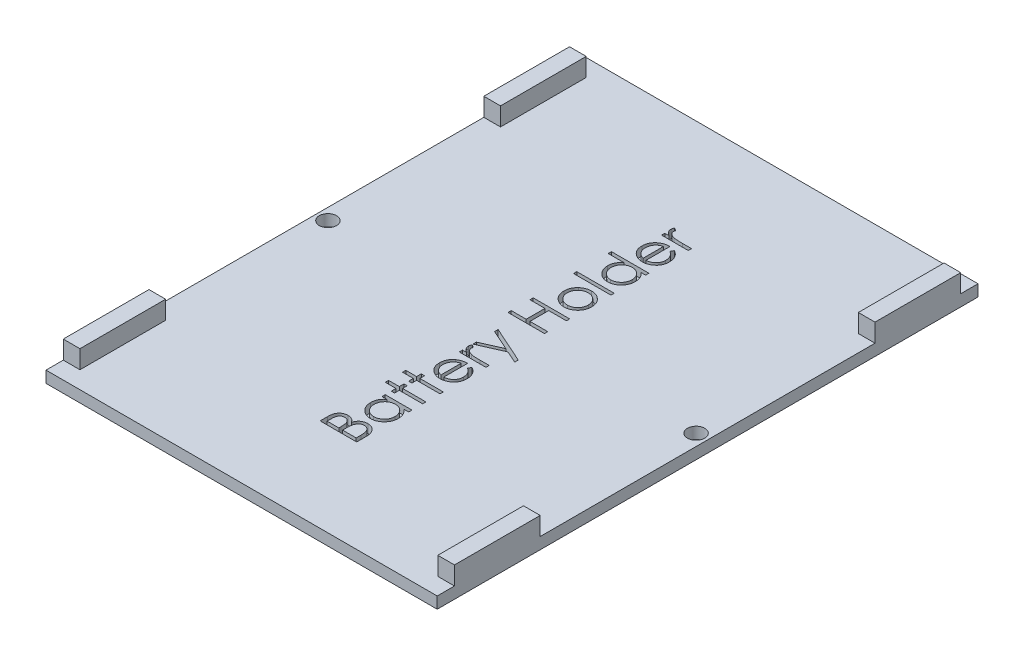
from build123d import *

# Parameters (mm, degrees)
SKETCH1_W               = 68
SKETCH1_H               = 94
BOSS_EXTRUDE1_DEPTH     = 2
SKETCH2_W               = 2.9
SKETCH2_H               = 14.9
BOSS_EXTRUDE2_DEPTH     = 3.175
MIRROR2_COPY_1_SKETCH_W = 2.9
MIRROR2_COPY_1_SKETCH_H = 14.9
MIRROR2_COPY_1_DEPTH    = 3.175
MIRROR2_COPY_2_SKETCH_W = 2.9
MIRROR2_COPY_2_SKETCH_H = 14.9
MIRROR2_COPY_2_DEPTH    = 3.175
SKETCH3_W               = 6.512820513
SKETCH3_H               = 0.569871795
CUT_EXTRUDE1_DEPTH      = 1.5
SKETCH4_R               = 1.5
CUT_EXTRUDE2_DEPTH      = 59.095444238


with BuildPart() as part:
    # Sketch1 → Boss-Extrude1 (new body)
    with BuildSketch(Plane(origin=(0, 0, 0), x_dir=(1, 0, 0), z_dir=(0, 1, 0))):
        Rectangle(SKETCH1_W, SKETCH1_H)
    extrude(amount=BOSS_EXTRUDE1_DEPTH)

    # Sketch2 → Boss-Extrude2 (add)
    with BuildSketch(Plane(origin=(0, 2, 0), x_dir=(1, 0, 0), z_dir=(0, 1, 0))):
        with Locations((-32.55, -36.55)):
            Rectangle(SKETCH2_W, SKETCH2_H)
    boss_extrude2 = extrude(amount=BOSS_EXTRUDE2_DEPTH)

    # Mirror1: Boss-Extrude2 across plane
    add(boss_extrude2.mirror(Plane(origin=(0, 0, 0), x_dir=(0, 0, 1), z_dir=(1, 0, 0))))

    # Mirror2 copy 1 sketch → Mirror2 copy 1 (add)
    with BuildSketch(Plane(origin=(0, 2, 0), x_dir=(-1, 0, 0), z_dir=(0, 1, 0))):
        with Locations((-32.55, -36.55)):
            Rectangle(MIRROR2_COPY_1_SKETCH_W, MIRROR2_COPY_1_SKETCH_H)
    extrude(amount=MIRROR2_COPY_1_DEPTH)

    # Mirror2 copy 2 sketch → Mirror2 copy 2 (add)
    with BuildSketch(Plane(origin=(0, 2, 0), x_dir=(1, 0, 0), z_dir=(0, 1, 0))):
        with Locations((-32.55, 36.55)):
            Rectangle(MIRROR2_COPY_2_SKETCH_W, MIRROR2_COPY_2_SKETCH_H)
    extrude(amount=MIRROR2_COPY_2_DEPTH)

    # Sketch3 → Cut-Extrude1 (cut)
    # profile 1 of 13: a face of its own
    with BuildSketch(Plane(origin=(0, 2, 0), x_dir=(1, 0, 0), z_dir=(0, 1, 0))):
        with BuildLine():
            Line((-2.530411002, -30.8210239), (-2.530411002, -29.58206156))
            add(Edge.make_bspline(
                [(-2.530411002, -29.58206156), (-2.530097161, -29.521411793), (-2.529488858, -29.403857451), (-2.519835528, -29.232929462), (-2.507002338, -29.072775876), (-2.485475354, -28.923679704), (-2.463154711, -28.7846708), (-2.43039335, -28.657160396), (-2.394207233, -28.540080434), (-2.338529982, -28.399491363), (-2.252062509, -28.239973798), (-2.12382303, -28.068522264), (-1.970074249, -27.919486129), (-1.794865387, -27.792761238), (-1.602115783, -27.691061817), (-1.395972509, -27.618417573), (-1.179903677, -27.571748144), (-1.031768516, -27.567008821), (-0.95690339, -27.564613643)],
                knots=[0, 0, 0, 0, 1.00128172, 1.940733171, 2.826250472, 3.653024905, 4.427672124, 5.149348099, 5.824709082, 6.450061444, 7.643590664, 8.808605388, 9.972104426, 11.165284501, 12.367876273, 13.557044126, 14.765369432, 16, 16, 16, 16], degree=3))
            add(Edge.make_bspline(
                [(-0.95690339, -27.564613643), (-0.886779694, -27.566608651), (-0.748980018, -27.57052903), (-0.54777965, -27.607560362), (-0.356449862, -27.666334379), (-0.175154403, -27.74756244), (-0.007268104, -27.852220252), (0.146688968, -27.977615022), (0.280898085, -28.128275836), (0.355900317, -28.24121169), (0.393998052, -28.298577986)],
                knots=[0, 0, 0, 0, 1.044641374, 2.052818814, 3.038628718, 4.023282556, 5.005660861, 5.98021751, 6.974042014, 8, 8, 8, 8], degree=3))
            add(Edge.make_bspline(
                [(0.393998052, -28.298577986), (0.421702089, -28.226448176), (0.474706776, -28.088445982), (0.568271915, -27.898425275), (0.670407208, -27.735307406), (0.78022089, -27.59590595), (0.900334095, -27.477311394), (1.031722688, -27.374601651), (1.174279106, -27.285807078), (1.32747941, -27.210243509), (1.49002485, -27.150887384), (1.659930094, -27.107261455), (1.836543812, -27.08145577), (1.956397417, -27.077935478), (2.017115039, -27.076152105)],
                knots=[0, 0, 0, 0, 1.272586185, 2.434772614, 3.483318042, 4.437947805, 5.351807173, 6.25737843, 7.180033415, 8.1141739, 9.066731021, 10.025721652, 10.999834114, 12, 12, 12, 12], degree=3))
            add(Edge.make_bspline(
                [(2.017115039, -27.076152105), (2.07910376, -27.077923995), (2.201068303, -27.081410239), (2.38023473, -27.107142293), (2.551471089, -27.150681338), (2.715806058, -27.210756663), (2.872895085, -27.288624284), (3.022169087, -27.384756221), (3.163938628, -27.497802974), (3.298453914, -27.625564078), (3.421539629, -27.767943834), (3.527351834, -27.924855488), (3.618335251, -28.092000427), (3.692410705, -28.271515438), (3.749559868, -28.462942258), (3.789377116, -28.666174366), (3.816250935, -28.880877069), (3.81845743, -29.028215838), (3.819588998, -29.103776304)],
                knots=[0, 0, 0, 0, 0.978680899, 1.925582087, 2.851223405, 3.764209995, 4.683484765, 5.614004905, 6.562443559, 7.542772147, 8.539900013, 9.527881485, 10.525548727, 11.540192123, 12.58875426, 13.674701727, 14.807505862, 16, 16, 16, 16], degree=3))
            Line((3.819588998, -29.103776304), (3.819588998, -30.8210239))
            Line((3.819588998, -30.8210239), (-2.530411002, -30.8210239))
        make_face()
        with BuildLine():
            Line((-1.879128951, -30.251152105), (0.156127459, -30.251152105))
            Line((0.156127459, -30.251152105), (0.156127459, -29.868269493))
            add(Edge.make_bspline(
                [(0.156127459, -29.868269493), (0.155401885, -29.812300964), (0.153999927, -29.70415836), (0.149983973, -29.547549407), (0.138738956, -29.402179725), (0.127497151, -29.268300275), (0.109219022, -29.146121781), (0.087461715, -29.035915259), (0.064451851, -28.935950022), (0.025316319, -28.820673831), (-0.032503154, -28.689894599), (-0.122321372, -28.550569735), (-0.229216392, -28.427173241), (-0.353712166, -28.324221412), (-0.489309956, -28.239219307), (-0.63481934, -28.179672659), (-0.787312129, -28.139974681), (-0.892200771, -28.136333929), (-0.945455073, -28.134485438)],
                knots=[0, 0, 0, 0, 1.156917035, 2.235399477, 3.236897345, 4.169954739, 5.01148057, 5.788325709, 6.491867502, 7.129259015, 8.302032419, 9.437271567, 10.542795419, 11.662606952, 12.764338259, 13.836858145, 14.901724648, 16, 16, 16, 16], degree=3))
            add(Edge.make_bspline(
                [(-0.945455073, -28.134485438), (-0.980703593, -28.135423988), (-1.049847414, -28.137265057), (-1.150970607, -28.152891179), (-1.245989317, -28.178209645), (-1.335815485, -28.212497673), (-1.418216716, -28.259340208), (-1.497130353, -28.31363686), (-1.567829855, -28.380673786), (-1.633718972, -28.456431464), (-1.692689511, -28.54311176), (-1.741537462, -28.642582202), (-1.785809937, -28.752271327), (-1.818583533, -28.875155063), (-1.847402773, -29.008687214), (-1.865510095, -29.154675858), (-1.877162328, -29.312195893), (-1.878458788, -29.421337493), (-1.879128951, -29.477754669)],
                knots=[0, 0, 0, 0, 0.911708768, 1.788416306, 2.640049961, 3.452993646, 4.268229297, 5.087074648, 5.92553149, 6.781184137, 7.681934069, 8.628939405, 9.643570426, 10.73771997, 11.914765019, 13.176320755, 14.540391495, 16, 16, 16, 16], degree=3))
            Line((-1.879128951, -29.477754669), (-1.879128951, -30.251152105))
        make_face(mode=Mode.SUBTRACT)
        with BuildLine():
            Line((0.80740951, -30.251152105), (3.168306946, -30.251152105))
            Line((3.168306946, -30.251152105), (3.168306946, -29.439593611))
            add(Edge.make_bspline(
                [(3.168306946, -29.439593611), (3.16754149, -29.381508207), (3.166066175, -29.269556248), (3.162606254, -29.107789562), (3.149517899, -28.958248104), (3.13744395, -28.820460125), (3.116798016, -28.694791316), (3.097313622, -28.580275024), (3.068390431, -28.478791114), (3.028638908, -28.360031459), (2.965001655, -28.227285615), (2.872028229, -28.082218302), (2.757284668, -27.955721853), (2.626785598, -27.84713646), (2.485284784, -27.757527078), (2.334632077, -27.69322387), (2.177757386, -27.653263564), (2.070770285, -27.648441979), (2.017115039, -27.6460239)],
                knots=[0, 0, 0, 0, 1.160376723, 2.23647316, 3.230273494, 4.158083346, 4.997711197, 5.773399541, 6.476071462, 7.102777513, 8.27340052, 9.405620712, 10.53304798, 11.669441455, 12.787990954, 13.865552736, 14.929550474, 16, 16, 16, 16], degree=3))
            add(Edge.make_bspline(
                [(2.017115039, -27.6460239), (1.983562113, -27.646523298), (1.916997473, -27.647514039), (1.819189307, -27.66252352), (1.724397728, -27.684237482), (1.632227723, -27.712835395), (1.54422901, -27.752813736), (1.460064112, -27.801823831), (1.378037555, -27.857924592), (1.272995444, -27.944477456), (1.153472093, -28.072207402), (1.037896825, -28.25372591), (0.943184013, -28.458979301), (0.90314349, -28.608195482), (0.882459591, -28.685276704)],
                knots=[0, 0, 0, 0, 0.723302347, 1.434937762, 2.129609326, 2.821140842, 3.513216847, 4.209993937, 4.920569932, 5.655069131, 7.14393391, 8.6716197, 10.280644748, 12, 12, 12, 12], degree=3))
            add(Edge.make_bspline(
                [(0.882459591, -28.685276704), (0.876191081, -28.71617235), (0.86259966, -28.783160481), (0.848252826, -28.892394235), (0.835471075, -29.01710074), (0.826016546, -29.15756796), (0.816243817, -29.313973614), (0.812443213, -29.486651738), (0.807908841, -29.674897152), (0.807580212, -29.805511885), (0.80740951, -29.873357634)],
                knots=[0, 0, 0, 0, 0.634451884, 1.375622551, 2.216452059, 3.157844607, 4.20941857, 5.370758133, 6.634282058, 8, 8, 8, 8], degree=3))
            Line((0.80740951, -29.873357634), (0.80740951, -30.251152105))
        make_face(mode=Mode.SUBTRACT)
    # profile 2 of 13: a face of its own
    with BuildSketch(Plane(origin=(0, 2, 0), x_dir=(1, 0, 0), z_dir=(0, 1, 0))):
        with BuildLine():
            Line((-0.820795618, -21.214613643), (3.819588998, -21.214613643))
            Line((3.819588998, -21.214613643), (3.819588998, -21.784485438))
            Line((3.819588998, -21.784485438), (3.016934751, -21.784485438))
            add(Edge.make_bspline(
                [(3.016934751, -21.784485438), (3.089458317, -21.848845564), (3.231199441, -21.97463194), (3.418072293, -22.182739249), (3.569388018, -22.406075228), (3.693372921, -22.639035721), (3.786129879, -22.883902634), (3.852177193, -23.139396127), (3.894611464, -23.405760293), (3.898850888, -23.587645832), (3.900999254, -23.67981797)],
                knots=[0, 0, 0, 0, 1.074325654, 2.099677833, 3.090439787, 4.057542011, 5.018572219, 5.985274637, 6.979019747, 8, 8, 8, 8], degree=3))
            add(Edge.make_bspline(
                [(3.900999254, -23.67981797), (3.898774264, -23.761765544), (3.894386486, -23.923369787), (3.860346307, -24.16109397), (3.80568075, -24.389861337), (3.729660565, -24.609888061), (3.628821074, -24.819750382), (3.508096239, -25.021245129), (3.364330733, -25.213328442), (3.199978167, -25.39307252), (3.021461547, -25.558593435), (2.831060341, -25.703847458), (2.629597875, -25.824956617), (2.419624867, -25.926230192), (2.199524942, -26.004237845), (1.970059223, -26.058618582), (1.731499024, -26.092619107), (1.569048746, -26.097005071), (1.486676337, -26.099229028)],
                knots=[0, 0, 0, 0, 1.033919861, 2.038935746, 3.024066025, 3.998881131, 4.97069526, 5.957263378, 6.95902576, 7.993208707, 9.027059324, 10.027763471, 11.009749337, 11.988697705, 12.965288445, 13.950418724, 14.960734635, 16, 16, 16, 16], degree=3))
            add(Edge.make_bspline(
                [(1.486676337, -26.099229028), (1.406006475, -26.09695578), (1.246526509, -26.092461691), (1.011978014, -26.058982278), (0.786066313, -26.002683162), (0.569518716, -25.923674924), (0.362073196, -25.822361663), (0.163583037, -25.699120705), (-0.026498584, -25.553943151), (-0.203702096, -25.386570926), (-0.367388068, -25.205260701), (-0.509644479, -25.011297717), (-0.63250219, -24.809506907), (-0.729844926, -24.596758302), (-0.808601444, -24.37620084), (-0.863089829, -24.145871017), (-0.895197826, -23.906727153), (-0.899847412, -23.744365832), (-0.902205874, -23.662009477)],
                knots=[0, 0, 0, 0, 1.020392517, 2.01726096, 2.990465484, 3.961182959, 4.928053699, 5.906110375, 6.912531644, 7.948652711, 8.985773172, 9.998621852, 10.987621588, 11.969261332, 12.953316658, 13.946091881, 14.958173133, 16, 16, 16, 16], degree=3))
            add(Edge.make_bspline(
                [(-0.902205874, -23.662009477), (-0.899594477, -23.567305812), (-0.894473649, -23.381596395), (-0.851946638, -23.109921646), (-0.779881316, -22.853030582), (-0.682529871, -22.608196057), (-0.550456569, -22.378788154), (-0.388513078, -22.161951085), (-0.190004084, -21.962298076), (-0.039429638, -21.844781624), (0.03782818, -21.784485438)],
                knots=[0, 0, 0, 0, 1.039007978, 2.037445607, 3.008437381, 3.96246474, 4.921201921, 5.904967172, 6.925065498, 8, 8, 8, 8], degree=3))
            Line((0.03782818, -21.784485438), (-0.820795618, -21.784485438))
            Line((-0.820795618, -21.784485438), (-0.820795618, -21.214613643))
        make_face()
        with BuildLine():
            add(Edge.make_bspline(
                [(-0.332334079, -23.654377265), (-0.329367657, -23.7376772), (-0.323512411, -23.902098021), (-0.277877183, -24.143503779), (-0.201748713, -24.374389266), (-0.098243136, -24.594395451), (0.034377046, -24.797387321), (0.190628108, -24.981989871), (0.373147508, -25.142511083), (0.575403401, -25.280558938), (0.79343028, -25.391380494), (1.021269951, -25.469801667), (1.254979364, -25.521426208), (1.413477516, -25.526706674), (1.493036514, -25.529357233)],
                knots=[0, 0, 0, 0, 1.031130969, 2.035288524, 3.029955243, 4.035265425, 5.037320146, 6.024362013, 7.021230137, 8.037832003, 9.049975902, 10.039737725, 11.016035826, 12, 12, 12, 12], degree=3))
            add(Edge.make_bspline(
                [(1.493036514, -25.529357233), (1.572116428, -25.52596013), (1.729966289, -25.519179238), (1.963655642, -25.470931949), (2.190983879, -25.388927099), (2.410762793, -25.278255397), (2.61499495, -25.138582824), (2.800792609, -24.978214278), (2.959487781, -24.792723558), (3.09242768, -24.58791681), (3.199747707, -24.369079124), (3.274438581, -24.138971479), (3.322657052, -23.901887134), (3.328289624, -23.740683803), (3.331127459, -23.659465406)],
                knots=[0, 0, 0, 0, 0.979154007, 1.954470061, 2.941101473, 3.965068436, 4.993389179, 5.998216918, 6.996159742, 8.005560442, 9.015493761, 10.005250788, 10.994993882, 12, 12, 12, 12], degree=3))
            add(Edge.make_bspline(
                [(3.331127459, -23.659465406), (3.328081018, -23.5770237), (3.32202195, -23.413055323), (3.27664491, -23.1706638), (3.198831454, -22.936240011), (3.094258218, -22.711383099), (2.964009561, -22.502114725), (2.81152357, -22.314930102), (2.635402968, -22.154779253), (2.439595679, -22.021441952), (2.226301032, -21.915698957), (1.99944403, -21.838381031), (1.758564202, -21.793175291), (1.59371765, -21.787422107), (1.509572972, -21.784485438)],
                knots=[0, 0, 0, 0, 1.01787422, 2.024450869, 3.03297362, 4.061474925, 5.080076323, 6.069755756, 7.033548292, 8.009625779, 8.9862229, 9.964937832, 10.961217871, 12, 12, 12, 12], degree=3))
            add(Edge.make_bspline(
                [(1.509572972, -21.784485438), (1.445460051, -21.786226529), (1.319265533, -21.789653547), (1.133977037, -21.815834723), (0.956660134, -21.857481518), (0.787128398, -21.916166712), (0.626319156, -21.993258043), (0.473077763, -22.086236132), (0.328201222, -22.19673602), (0.193684507, -22.322978911), (0.070990783, -22.46116435), (-0.038527197, -22.607385874), (-0.128495399, -22.763375886), (-0.202955991, -22.926511082), (-0.26220902, -23.097074503), (-0.301738122, -23.276454056), (-0.328880419, -23.462743075), (-0.331170738, -23.589826632), (-0.332334079, -23.654377265)],
                knots=[0, 0, 0, 0, 1.050140795, 2.067009409, 3.05949893, 4.030605086, 5.00011959, 5.97591094, 6.962425594, 7.979863591, 8.993523472, 9.986985069, 10.967611495, 11.937549037, 12.921786183, 13.919465291, 14.943216303, 16, 16, 16, 16], degree=3))
        make_face(mode=Mode.SUBTRACT)
    # profile 3 of 13: a face of its own
    with BuildSketch(Plane(origin=(0, 2, 0), x_dir=(1, 0, 0), z_dir=(0, 1, 0))):
        Polygon((-2.693231515, -19.342177746), (-2.693231515, -18.772305951), (-0.820795618, -18.772305951), (-0.820795618, -17.958203387), (-0.250923823, -17.958203387), (-0.250923823, -18.772305951), (3.819588998, -18.772305951), (3.819588998, -19.342177746), (-0.250923823, -19.342177746), (-0.250923823, -20.15628031), (-0.820795618, -20.15628031), (-0.820795618, -19.342177746), align=None)
    # profile 4 of 13: a face of its own
    with BuildSketch(Plane(origin=(0, 2, 0), x_dir=(1, 0, 0), z_dir=(0, 1, 0))):
        Polygon((-2.693231515, -16.329998259), (-2.693231515, -15.760126464), (-0.820795618, -15.760126464), (-0.820795618, -14.9460239), (-0.250923823, -14.9460239), (-0.250923823, -15.760126464), (3.819588998, -15.760126464), (3.819588998, -16.329998259), (-0.250923823, -16.329998259), (-0.250923823, -17.144100823), (-0.820795618, -17.144100823), (-0.820795618, -16.329998259), align=None)
    # profile 5 of 13: a face of its own
    with BuildSketch(Plane(origin=(0, 2, 0), x_dir=(1, 0, 0), z_dir=(0, 1, 0))):
        with BuildLine():
            Line((2.354204382, -10.079217009), (2.620059751, -9.572946977))
            add(Edge.make_bspline(
                [(2.620059751, -9.572946977), (2.69160426, -9.613311679), (2.830801541, -9.691845405), (3.022052599, -9.826350964), (3.193080841, -9.968642612), (3.341147612, -10.123049716), (3.471908957, -10.284919338), (3.58469793, -10.457325885), (3.681549649, -10.638862108), (3.760910597, -10.831527538), (3.82330076, -11.035091381), (3.869376321, -11.250734858), (3.896095768, -11.479476158), (3.899338706, -11.636117891), (3.900999254, -11.716326384)],
                knots=[0, 0, 0, 0, 1.120611642, 2.180266485, 3.186550691, 4.152466804, 5.095166165, 6.022949561, 6.960161436, 7.899497276, 8.862391909, 9.862399089, 10.905440174, 12, 12, 12, 12], degree=3))
            add(Edge.make_bspline(
                [(3.900999254, -11.716326384), (3.89891795, -11.805483971), (3.894857929, -11.979404596), (3.859855887, -12.232569568), (3.802756034, -12.470929362), (3.722989991, -12.694470622), (3.618800378, -12.902645756), (3.491874033, -13.095869091), (3.342862113, -13.275154599), (3.170477203, -13.434860773), (2.985989413, -13.578612864), (2.79378288, -13.705546788), (2.594523235, -13.81117401), (2.389396031, -13.898408459), (2.178867397, -13.967219908), (1.961731612, -14.016118385), (1.738849683, -14.044045954), (1.588090507, -14.048344748), (1.512117042, -14.050511079)],
                knots=[0, 0, 0, 0, 1.14524686, 2.234044844, 3.276713788, 4.290115724, 5.276966211, 6.260758605, 7.254862358, 8.264742877, 9.274005885, 10.257798278, 11.220590477, 12.167824544, 13.118936889, 14.062732937, 15.023735098, 16, 16, 16, 16], degree=3))
            add(Edge.make_bspline(
                [(1.512117042, -14.050511079), (1.440824993, -14.048589494), (1.299533566, -14.044781167), (1.090408935, -14.020776738), (0.887157314, -13.978234835), (0.689609815, -13.91985779), (0.498097201, -13.844471958), (0.312502914, -13.752247789), (0.133024446, -13.643041617), (0.019807332, -13.558726909), (-0.0372219, -13.516256272)],
                knots=[0, 0, 0, 0, 1.024358464, 2.0301432, 3.019427413, 4.004406732, 4.986367066, 5.972626655, 6.978780325, 8, 8, 8, 8], degree=3))
            add(Edge.make_bspline(
                [(-0.0372219, -13.516256272), (-0.106040767, -13.458828651), (-0.241277437, -13.345977037), (-0.417353545, -13.153124343), (-0.567971605, -12.9471126), (-0.690846115, -12.725869575), (-0.785356041, -12.489767941), (-0.852579701, -12.240025492), (-0.894409333, -11.975951946), (-0.899567515, -11.794926641), (-0.902205874, -11.702333996)],
                knots=[0, 0, 0, 0, 1.030811313, 2.025658015, 2.997072178, 3.962767568, 4.930766827, 5.917075773, 6.934604948, 8, 8, 8, 8], degree=3))
            add(Edge.make_bspline(
                [(-0.902205874, -11.702333996), (-0.899761546, -11.607173583), (-0.894966333, -11.420490546), (-0.850113286, -11.148366719), (-0.779848294, -10.890371832), (-0.677475536, -10.648634986), (-0.550577511, -10.41943137), (-0.390184348, -10.208036082), (-0.20453403, -10.008646182), (-0.06161221, -9.892709905), (0.01111544, -9.833714204)],
                knots=[0, 0, 0, 0, 1.056389096, 2.072394598, 3.055233004, 4.020130009, 4.981825462, 5.957811105, 6.960805292, 8, 8, 8, 8], degree=3))
            add(Edge.make_bspline(
                [(0.01111544, -9.833714204), (0.065913366, -9.793569616), (0.175144467, -9.713547654), (0.353254995, -9.61331363), (0.539601359, -9.526305214), (0.737195755, -9.45675827), (0.943696994, -9.400443746), (1.160581325, -9.359700661), (1.387784164, -9.33580721), (1.542590915, -9.331110573), (1.621512075, -9.328716208)],
                knots=[0, 0, 0, 0, 0.94817472, 1.890038105, 2.849395472, 3.817997239, 4.812318967, 5.836947057, 6.897266129, 8, 8, 8, 8], degree=3))
            Line((1.621512075, -9.328716208), (1.621512075, -13.480639284))
            add(Edge.make_bspline(
                [(1.621512075, -13.480639284), (1.682654345, -13.477845999), (1.802888155, -13.472353114), (1.978820861, -13.446744212), (2.146412497, -13.406378579), (2.304406016, -13.349647566), (2.454864961, -13.280946289), (2.596673228, -13.196789346), (2.729184901, -13.096387584), (2.85358528, -12.984399529), (2.964366946, -12.859745228), (3.063520883, -12.728603672), (3.146625323, -12.589096776), (3.214080266, -12.442324538), (3.266887439, -12.2885243), (3.302933342, -12.127647603), (3.327076236, -11.96001102), (3.329760772, -11.845736903), (3.331127459, -11.787560358)],
                knots=[0, 0, 0, 0, 1.094153842, 2.151609401, 3.174256925, 4.172055639, 5.149267565, 6.128595816, 7.11444997, 8.118368179, 9.117203808, 10.09244225, 11.054858984, 12.015122123, 12.976791628, 13.957293641, 14.960065497, 16, 16, 16, 16], degree=3))
            add(Edge.make_bspline(
                [(3.331127459, -11.787560358), (3.330033154, -11.730677937), (3.327861843, -11.617812302), (3.306445943, -11.449771877), (3.2725036, -11.284162388), (3.223616302, -11.122628295), (3.166369935, -10.967523752), (3.098991331, -10.823094965), (3.022172096, -10.691251353), (2.934876658, -10.567545488), (2.827742228, -10.448206478), (2.695333436, -10.32794744), (2.5361485, -10.201844197), (2.417134665, -10.121630931), (2.354204382, -10.079217009)],
                knots=[0, 0, 0, 0, 0.991168677, 1.966668791, 2.94808785, 3.9350306, 4.905702032, 5.828266021, 6.709360349, 7.562606342, 8.463112863, 9.498839253, 10.677475166, 12, 12, 12, 12], degree=3))
        make_face()
        with BuildLine():
            add(Edge.make_bspline(
                [(1.05164028, -9.898588002), (0.97601415, -9.919361697), (0.830836549, -9.959240443), (0.629870914, -10.044169161), (0.450235263, -10.137510622), (0.294914741, -10.249875374), (0.156748487, -10.375944315), (0.037937132, -10.523574092), (-0.071569017, -10.686361834), (-0.162761569, -10.867549944), (-0.237699897, -11.059993264), (-0.292802733, -11.259736325), (-0.325193831, -11.465106097), (-0.329942808, -11.603427615), (-0.332334079, -11.673077185)],
                knots=[0, 0, 0, 0, 1.155085888, 2.217389643, 3.210301801, 4.133263417, 5.03575695, 5.95948047, 6.920061569, 7.923798377, 8.943125483, 9.960783337, 10.973185325, 12, 12, 12, 12], degree=3))
            add(Edge.make_bspline(
                [(-0.332334079, -11.673077185), (-0.331237273, -11.72995837), (-0.329069118, -11.842400513), (-0.308072053, -12.00798394), (-0.274332102, -12.167414901), (-0.224722698, -12.320217502), (-0.164357857, -12.467405338), (-0.090157255, -12.608872054), (-0.000447428, -12.742799071), (0.068081441, -12.826503267), (0.102701978, -12.868790326)],
                knots=[0, 0, 0, 0, 1.048823158, 2.073302879, 3.073550078, 4.050623576, 5.03253758, 6.005186856, 6.992227572, 8, 8, 8, 8], degree=3))
            add(Edge.make_bspline(
                [(0.102701978, -12.868790326), (0.130084501, -12.899081456), (0.185500054, -12.960383319), (0.281029397, -13.042207038), (0.384099964, -13.121134617), (0.499210882, -13.191273272), (0.623024058, -13.257929651), (0.756442927, -13.318670894), (0.900030653, -13.373899646), (1.000136974, -13.404902891), (1.05164028, -13.420853627)],
                knots=[0, 0, 0, 0, 0.879905587, 1.780714457, 2.708106151, 3.677566983, 4.684151534, 5.740052498, 6.837288539, 8, 8, 8, 8], degree=3))
            Line((1.05164028, -13.420853627), (1.05164028, -9.898588002))
        make_face(mode=Mode.SUBTRACT)
    # profile 6 of 13: a face of its own
    with BuildSketch(Plane(origin=(0, 2, 0), x_dir=(1, 0, 0), z_dir=(0, 1, 0))):
        with BuildLine():
            Line((-0.820795618, -8.351793131), (-0.820795618, -7.781921336))
            Line((-0.820795618, -7.781921336), (-0.137712685, -7.781921336))
            add(Edge.make_bspline(
                [(-0.137712685, -7.781921336), (-0.201342446, -7.739877221), (-0.323033871, -7.659468178), (-0.483762564, -7.525193223), (-0.618359259, -7.389122567), (-0.724257173, -7.247683245), (-0.804290136, -7.102261958), (-0.860526792, -6.954084968), (-0.895400854, -6.802789928), (-0.899934496, -6.70087159), (-0.902205874, -6.649809958)],
                knots=[0, 0, 0, 0, 1.280091057, 2.448164201, 3.510831157, 4.48793739, 5.405868014, 6.289422536, 7.142991551, 8, 8, 8, 8], degree=3))
            add(Edge.make_bspline(
                [(-0.902205874, -6.649809958), (-0.900045919, -6.610210765), (-0.89560167, -6.528732853), (-0.864376317, -6.405393012), (-0.814523333, -6.278314178), (-0.767641786, -6.196412989), (-0.743201467, -6.153716208)],
                knots=[0, 0, 0, 0, 0.901110191, 1.854092781, 2.881294221, 4, 4, 4, 4], degree=3))
            Line((-0.743201467, -6.153716208), (-0.249651788, -6.466636881))
            add(Edge.make_bspline(
                [(-0.249651788, -6.466636881), (-0.261880556, -6.494048962), (-0.2850931, -6.54608234), (-0.312565033, -6.62219991), (-0.328741051, -6.692378906), (-0.331191639, -6.737089362), (-0.332334079, -6.757932954)],
                knots=[0, 0, 0, 0, 1.180555205, 2.24091978, 3.179933427, 4, 4, 4, 4], degree=3))
            add(Edge.make_bspline(
                [(-0.332334079, -6.757932954), (-0.329309882, -6.803677086), (-0.323141395, -6.896981856), (-0.273954902, -7.033509276), (-0.196770074, -7.167177456), (-0.108879375, -7.272312109), (-0.024452672, -7.354003706), (0.04943931, -7.412754229), (0.133061198, -7.465483699), (0.223180819, -7.516632685), (0.32205992, -7.564153954), (0.429859809, -7.606621189), (0.545690316, -7.646336229), (0.626229968, -7.66870191), (0.667485632, -7.680158515)],
                knots=[0, 0, 0, 0, 1.125322384, 2.295331465, 3.535939348, 4.916963136, 5.656144286, 6.429838446, 7.238666481, 8.090384391, 8.983239461, 9.940052224, 10.944811494, 12, 12, 12, 12], degree=3))
            add(Edge.make_bspline(
                [(0.667485632, -7.680158515), (0.704272182, -7.688759267), (0.786160191, -7.70790481), (0.92291633, -7.72602298), (1.084385268, -7.744645504), (1.270754582, -7.757362814), (1.482740681, -7.769376008), (1.719429056, -7.776012592), (1.981470249, -7.781710183), (2.164242952, -7.781848706), (2.260073773, -7.781921336)],
                knots=[0, 0, 0, 0, 0.566841273, 1.261806378, 2.068780918, 3.007109044, 4.065315289, 5.256255371, 6.561408263, 8, 8, 8, 8], degree=3))
            Line((2.260073773, -7.781921336), (3.819588998, -7.781921336))
            Line((3.819588998, -7.781921336), (3.819588998, -8.351793131))
            Line((3.819588998, -8.351793131), (-0.820795618, -8.351793131))
        make_face()
    # profile 7 of 13: a face of its own
    with BuildSketch(Plane(origin=(0, 2, 0), x_dir=(1, 0, 0), z_dir=(0, 1, 0))):
        Polygon((-0.820795618, -5.990895695), (-0.820795618, -5.376502666), (2.733270889, -3.805539124), (-0.820795618, -2.210406913), (-0.820795618, -1.594741849), (5.529204382, -4.444100823), (5.529204382, -5.059765887), (3.423986033, -4.114643692), align=None)
    # profile 8 of 13: a face of its own
    with BuildSketch(Plane(origin=(0, 2, 0), x_dir=(1, 0, 0), z_dir=(0, 1, 0))):
        Polygon((-2.530411002, 1.824488921), (-2.530411002, 2.394360716), (0.074717203, 2.394360716), (0.074717203, 5.650770972), (-2.530411002, 5.650770972), (-2.530411002, 6.220642767), (3.819588998, 6.220642767), (3.819588998, 5.650770972), (0.725999254, 5.650770972), (0.725999254, 2.394360716), (3.819588998, 2.394360716), (3.819588998, 1.824488921), align=None)
    # profile 9 of 13: a face of its own
    with BuildSketch(Plane(origin=(0, 2, 0), x_dir=(1, 0, 0), z_dir=(0, 1, 0))):
        with BuildLine():
            add(Edge.make_bspline(
                [(-0.902205874, 9.927353504), (-0.900351872, 10.014423385), (-0.896716626, 10.185146142), (-0.85786376, 10.435169021), (-0.798450684, 10.673829482), (-0.716315136, 10.902041573), (-0.60622074, 11.116882566), (-0.474849597, 11.321481823), (-0.319215463, 11.515278397), (-0.198822968, 11.631434464), (-0.137712685, 11.690394369)],
                knots=[0, 0, 0, 0, 1.054011418, 2.066658804, 3.057071809, 4.030435133, 4.997543892, 5.974964718, 6.972108034, 8, 8, 8, 8], degree=3))
            add(Edge.make_bspline(
                [(-0.137712685, 11.690394369), (-0.079267311, 11.741161629), (0.036492359, 11.841713662), (0.224190399, 11.97064718), (0.418573153, 12.081720582), (0.622221874, 12.170734811), (0.833358778, 12.240920497), (1.052709569, 12.290751117), (1.279789828, 12.320390985), (1.434011077, 12.324387797), (1.512117042, 12.326411998)],
                knots=[0, 0, 0, 0, 1.025258237, 2.030674902, 3.01204498, 3.988269485, 4.97094183, 5.956517959, 6.965070386, 8, 8, 8, 8], degree=3))
            add(Edge.make_bspline(
                [(1.512117042, 12.326411998), (1.590675719, 12.324631571), (1.745911326, 12.321113366), (1.974546461, 12.287832805), (2.196242782, 12.236069263), (2.410072127, 12.161988643), (2.616688114, 12.066996073), (2.815188296, 11.951080111), (3.005964309, 11.81342732), (3.187396216, 11.657391497), (3.354612063, 11.484940236), (3.500350494, 11.297858082), (3.625212403, 11.099821478), (3.7257899, 10.888197108), (3.805091785, 10.664917525), (3.860790386, 10.42950113), (3.894466584, 10.182313645), (3.898791067, 10.013535686), (3.900999254, 9.927353504)],
                knots=[0, 0, 0, 0, 0.998656419, 1.973391657, 2.932242238, 3.890759089, 4.846373663, 5.82037756, 6.809684879, 7.83454468, 8.860553229, 9.859544525, 10.845671541, 11.83227036, 12.833544569, 13.85385346, 14.904124723, 16, 16, 16, 16], degree=3))
            add(Edge.make_bspline(
                [(3.900999254, 9.927353504), (3.898783655, 9.840749084), (3.894444293, 9.671129953), (3.860921223, 9.423069957), (3.805117454, 9.187231649), (3.725529289, 8.963659763), (3.625209188, 8.75112554), (3.50072798, 8.551941467), (3.354568841, 8.364707335), (3.187407927, 8.192219592), (3.005961292, 8.036193551), (2.815189079, 7.898538236), (2.61668791, 7.78262293), (2.410072181, 7.687630188), (2.196242768, 7.613549613), (1.974546465, 7.56178606), (1.745911325, 7.528505502), (1.590675718, 7.524987296), (1.512117042, 7.523206869)],
                knots=[0, 0, 0, 0, 1.099876186, 2.154163076, 3.173186993, 4.173200201, 5.163417411, 6.152872554, 7.150605724, 8.17532212, 9.198891216, 10.186952605, 11.159729845, 12.11414092, 13.071450619, 14.029093627, 15.002601286, 16, 16, 16, 16], degree=3))
            add(Edge.make_bspline(
                [(1.512117042, 7.523206869), (1.434433862, 7.525240033), (1.280634514, 7.529265349), (1.054006281, 7.558945666), (0.83532683, 7.60823409), (0.625342903, 7.679392751), (0.422183647, 7.768241742), (0.227088181, 7.878197239), (0.040210302, 8.008377973), (-0.075395856, 8.108539363), (-0.133896579, 8.159224498)],
                knots=[0, 0, 0, 0, 1.031377469, 2.041950136, 3.029500481, 4.003457997, 4.981637986, 5.969878303, 6.97268806, 8, 8, 8, 8], degree=3))
            add(Edge.make_bspline(
                [(-0.133896579, 8.159224498), (-0.195536826, 8.218095513), (-0.316763218, 8.333875723), (-0.471943655, 8.528636986), (-0.606048531, 8.732732919), (-0.713955379, 8.949948142), (-0.798933833, 9.177972755), (-0.858016982, 9.417856238), (-0.89657664, 9.668727531), (-0.900310763, 9.8402857), (-0.902205874, 9.927353504)],
                knots=[0, 0, 0, 0, 1.027980169, 2.021703884, 2.998553061, 3.971491411, 4.943284454, 5.930300938, 6.949603206, 8, 8, 8, 8], degree=3))
        make_face()
        with BuildLine():
            add(Edge.make_bspline(
                [(-0.332334079, 9.924809433), (-0.330584035, 9.86323691), (-0.327129122, 9.741681348), (-0.30085118, 9.562757246), (-0.259217854, 9.390508674), (-0.200064769, 9.224608882), (-0.123685382, 9.065617174), (-0.029871477, 8.913381907), (0.080133392, 8.767453074), (0.206160994, 8.63069392), (0.343818006, 8.505157227), (0.490533128, 8.395505904), (0.644058988, 8.301742213), (0.804626615, 8.225049081), (0.972783484, 8.166230894), (1.147539315, 8.12455121), (1.329421809, 8.098225151), (1.453089168, 8.094812745), (1.515933148, 8.093078664)],
                knots=[0, 0, 0, 0, 1.02155314, 2.01673505, 2.994700672, 3.958461264, 4.934171024, 5.916582427, 6.921469794, 7.962398674, 8.998583302, 10.009097305, 10.997513862, 11.97957236, 12.956600784, 13.948243505, 14.957359924, 16, 16, 16, 16], degree=3))
            add(Edge.make_bspline(
                [(1.515933148, 8.093078664), (1.597126112, 8.095993901), (1.758278962, 8.101780102), (1.995607713, 8.148834031), (2.223449073, 8.227549139), (2.440467374, 8.333843203), (2.641258507, 8.467023057), (2.820276771, 8.623935307), (2.974828172, 8.802895906), (3.10306342, 9.001771556), (3.204953263, 9.216500105), (3.277159976, 9.443750859), (3.324098618, 9.680770404), (3.328764007, 9.842751159), (3.331127459, 9.924809433)],
                knots=[0, 0, 0, 0, 1.016792936, 2.018143844, 3.017858371, 4.030088057, 5.03801393, 6.028138512, 7.003788237, 7.991172063, 8.984598303, 9.972568034, 10.972917682, 12, 12, 12, 12], degree=3))
            add(Edge.make_bspline(
                [(3.331127459, 9.924809433), (3.328750236, 10.006862989), (3.324057665, 10.168834427), (3.277396377, 10.405524648), (3.204636879, 10.632154282), (3.103178012, 10.8466598), (2.974341203, 11.045444923), (2.82114949, 11.225692615), (2.64078436, 11.381265095), (2.440201414, 11.514313207), (2.223785518, 11.622348011), (1.995565662, 11.700694677), (1.758289671, 11.747861726), (1.5971297, 11.753632658), (1.515933148, 11.756540203)],
                knots=[0, 0, 0, 0, 1.02726834, 2.027799167, 3.010890988, 4.004497153, 4.992059811, 5.971914811, 6.958719428, 7.966827853, 8.981595046, 9.981490638, 10.983022906, 12, 12, 12, 12], degree=3))
            add(Edge.make_bspline(
                [(1.515933148, 11.756540203), (1.453088793, 11.75480672), (1.329420695, 11.751395492), (1.147543573, 11.725060871), (0.972767906, 11.683412802), (0.804683979, 11.624478353), (0.643642395, 11.548125887), (0.490983158, 11.452559698), (0.343309893, 11.343356237), (0.206606005, 11.216304967), (0.080084267, 11.079688554), (-0.029914135, 10.933700585), (-0.123273079, 10.781691057), (-0.200718072, 10.623161247), (-0.258679687, 10.457240186), (-0.301091573, 10.285232959), (-0.327018073, 10.107072263), (-0.330550744, 9.985952284), (-0.332334079, 9.924809433)],
                knots=[0, 0, 0, 0, 1.042975879, 2.052417305, 3.044379404, 4.0217225, 5.00409729, 5.996508862, 7.007348322, 8.048612455, 9.089876587, 10.095087598, 11.077815406, 12.047498138, 13.018202342, 13.98964644, 14.985148868, 16, 16, 16, 16], degree=3))
        make_face(mode=Mode.SUBTRACT)
    # profile 10 of 13: a face of its own
    with BuildSketch(Plane(origin=(0, 2, 0), x_dir=(1, 0, 0), z_dir=(0, 1, 0))):
        with Locations((0.563178742, 13.669681229)):
            Rectangle(SKETCH3_W, SKETCH3_H)
    # profile 11 of 13: a face of its own
    with BuildSketch(Plane(origin=(0, 2, 0), x_dir=(1, 0, 0), z_dir=(0, 1, 0))):
        with BuildLine():
            Line((-2.693231515, 19.9789761), (3.819588998, 19.9789761))
            Line((3.819588998, 19.9789761), (3.819588998, 19.409104305))
            Line((3.819588998, 19.409104305), (3.016934751, 19.409104305))
            add(Edge.make_bspline(
                [(3.016934751, 19.409104305), (3.089458317, 19.344744179), (3.231199441, 19.218957804), (3.418072293, 19.010850495), (3.569388018, 18.787514516), (3.693372921, 18.554554023), (3.786129879, 18.309687109), (3.852177193, 18.054193616), (3.894611464, 17.787829451), (3.898850888, 17.605943911), (3.900999254, 17.513771773)],
                knots=[0, 0, 0, 0, 1.074325654, 2.099677833, 3.090439787, 4.057542011, 5.018572219, 5.985274637, 6.979019747, 8, 8, 8, 8], degree=3))
            add(Edge.make_bspline(
                [(3.900999254, 17.513771773), (3.898774264, 17.4318242), (3.894386486, 17.270219957), (3.860346307, 17.032495774), (3.80568075, 16.803728407), (3.729660565, 16.583701682), (3.628821074, 16.373839361), (3.508096239, 16.172344615), (3.364330733, 15.980261302), (3.199978167, 15.800517224), (3.021461547, 15.634996309), (2.831060341, 15.489742286), (2.629597875, 15.368633127), (2.419624867, 15.267359552), (2.199524942, 15.189351898), (1.970059223, 15.134971162), (1.731499024, 15.100970637), (1.569048746, 15.096584673), (1.486676337, 15.094360716)],
                knots=[0, 0, 0, 0, 1.033919861, 2.038935746, 3.024066025, 3.998881131, 4.97069526, 5.957263378, 6.95902576, 7.993208707, 9.027059324, 10.027763471, 11.009749337, 11.988697705, 12.965288445, 13.950418724, 14.960734635, 16, 16, 16, 16], degree=3))
            add(Edge.make_bspline(
                [(1.486676337, 15.094360716), (1.406006475, 15.096633964), (1.246526509, 15.101128052), (1.011978014, 15.134607466), (0.786066313, 15.190906581), (0.569518716, 15.269914819), (0.362073196, 15.37122808), (0.163583037, 15.494469038), (-0.026498584, 15.639646593), (-0.203702096, 15.807018817), (-0.367388068, 15.988329043), (-0.509644479, 16.182292026), (-0.63250219, 16.384082837), (-0.729844926, 16.596831442), (-0.808601444, 16.817388903), (-0.863089829, 17.047718726), (-0.895197826, 17.28686259), (-0.899847412, 17.449223912), (-0.902205874, 17.531580267)],
                knots=[0, 0, 0, 0, 1.020392517, 2.01726096, 2.990465484, 3.961182959, 4.928053699, 5.906110375, 6.912531644, 7.948652711, 8.985773172, 9.998621852, 10.987621588, 11.969261332, 12.953316658, 13.946091881, 14.958173133, 16, 16, 16, 16], degree=3))
            add(Edge.make_bspline(
                [(-0.902205874, 17.531580267), (-0.899398961, 17.626326733), (-0.893889302, 17.812303515), (-0.84675708, 18.083995845), (-0.770391885, 18.341661381), (-0.66302266, 18.58585073), (-0.522096881, 18.814422606), (-0.354099284, 19.031172066), (-0.152005393, 19.230640257), (-0.000326104, 19.348709318), (0.077261273, 19.409104305)],
                knots=[0, 0, 0, 0, 1.030935089, 2.023611011, 2.991955418, 3.950956655, 4.918431382, 5.908366361, 6.930082213, 8, 8, 8, 8], degree=3))
            Line((0.077261273, 19.409104305), (-2.693231515, 19.409104305))
            Line((-2.693231515, 19.409104305), (-2.693231515, 19.9789761))
        make_face()
        with BuildLine():
            add(Edge.make_bspline(
                [(-0.332334079, 17.539212478), (-0.329367657, 17.455912544), (-0.323512411, 17.291491722), (-0.277877183, 17.050085964), (-0.201748713, 16.819200478), (-0.098243136, 16.599194293), (0.034377046, 16.396202422), (0.190628108, 16.211599873), (0.373147508, 16.05107866), (0.575403401, 15.913030806), (0.79343028, 15.80220925), (1.021269951, 15.723788076), (1.254979364, 15.672163536), (1.413477516, 15.666883069), (1.493036514, 15.66423251)],
                knots=[0, 0, 0, 0, 1.031130969, 2.035288524, 3.029955243, 4.035265425, 5.037320146, 6.024362013, 7.021230137, 8.037832003, 9.049975902, 10.039737725, 11.016035826, 12, 12, 12, 12], degree=3))
            add(Edge.make_bspline(
                [(1.493036514, 15.66423251), (1.572116428, 15.667629614), (1.729966289, 15.674410505), (1.963655642, 15.722657795), (2.190983879, 15.804662645), (2.410762793, 15.915334346), (2.61499495, 16.055006919), (2.800792609, 16.215375465), (2.959487781, 16.400866185), (3.09242768, 16.605672933), (3.199747707, 16.82451062), (3.274438581, 17.054618264), (3.322657052, 17.291702609), (3.328289624, 17.45290594), (3.331127459, 17.534124337)],
                knots=[0, 0, 0, 0, 0.979154007, 1.954470061, 2.941101473, 3.965068436, 4.993389179, 5.998216918, 6.996159742, 8.005560442, 9.015493761, 10.005250788, 10.994993882, 12, 12, 12, 12], degree=3))
            add(Edge.make_bspline(
                [(3.331127459, 17.534124337), (3.328081018, 17.616566043), (3.32202195, 17.78053442), (3.27664491, 18.022925944), (3.198831454, 18.257349732), (3.094258218, 18.482206644), (2.964009561, 18.691475019), (2.81152357, 18.878659641), (2.635402968, 19.038810491), (2.439595679, 19.172147792), (2.226301032, 19.277890786), (1.99944403, 19.355208713), (1.758564202, 19.400414452), (1.59371765, 19.406167636), (1.509572972, 19.409104305)],
                knots=[0, 0, 0, 0, 1.01787422, 2.024450869, 3.03297362, 4.061474925, 5.080076323, 6.069755756, 7.033548292, 8.009625779, 8.9862229, 9.964937832, 10.961217871, 12, 12, 12, 12], degree=3))
            add(Edge.make_bspline(
                [(1.509572972, 19.409104305), (1.445460051, 19.407363214), (1.319265533, 19.403936197), (1.133977037, 19.377755021), (0.956660134, 19.336108225), (0.787128398, 19.277423031), (0.626319156, 19.200331701), (0.473077763, 19.107353611), (0.328201222, 18.996853724), (0.193684507, 18.870610833), (0.070990783, 18.732425394), (-0.038527197, 18.58620387), (-0.128495399, 18.430213858), (-0.202955991, 18.267078662), (-0.26220902, 18.096515241), (-0.301738122, 17.917135688), (-0.328880419, 17.730846669), (-0.331170738, 17.603763111), (-0.332334079, 17.539212478)],
                knots=[0, 0, 0, 0, 1.050140795, 2.067009409, 3.05949893, 4.030605086, 5.00011959, 5.97591094, 6.962425594, 7.979863591, 8.993523472, 9.986985069, 10.967611495, 11.937549037, 12.921786183, 13.919465291, 14.943216303, 16, 16, 16, 16], degree=3))
        make_face(mode=Mode.SUBTRACT)
    # profile 12 of 13: a face of its own
    with BuildSketch(Plane(origin=(0, 2, 0), x_dir=(1, 0, 0), z_dir=(0, 1, 0))):
        with BuildLine():
            Line((2.354204382, 25.09001376), (2.620059751, 25.596283792))
            add(Edge.make_bspline(
                [(2.620059751, 25.596283792), (2.69160426, 25.55591909), (2.830801541, 25.477385365), (3.022052599, 25.342879805), (3.193080841, 25.200588157), (3.341147612, 25.046181053), (3.471908957, 24.884311431), (3.58469793, 24.711904884), (3.681549649, 24.530368661), (3.760910597, 24.337703231), (3.82330076, 24.134139388), (3.869376321, 23.918495911), (3.896095768, 23.689754611), (3.899338706, 23.533112878), (3.900999254, 23.452904385)],
                knots=[0, 0, 0, 0, 1.120611642, 2.180266485, 3.186550691, 4.152466804, 5.095166165, 6.022949561, 6.960161436, 7.899497276, 8.862391909, 9.862399089, 10.905440174, 12, 12, 12, 12], degree=3))
            add(Edge.make_bspline(
                [(3.900999254, 23.452904385), (3.89891795, 23.363746798), (3.894857929, 23.189826173), (3.859855887, 22.936661201), (3.802756034, 22.698301407), (3.722989991, 22.474760147), (3.618800378, 22.266585013), (3.491874033, 22.073361679), (3.342862113, 21.89407617), (3.170477203, 21.734369996), (2.985989413, 21.590617905), (2.79378288, 21.463683982), (2.594523235, 21.358056759), (2.389396031, 21.270822311), (2.178867397, 21.202010861), (1.961731612, 21.153112385), (1.738849683, 21.125184815), (1.588090507, 21.120886021), (1.512117042, 21.11871969)],
                knots=[0, 0, 0, 0, 1.14524686, 2.234044844, 3.276713788, 4.290115724, 5.276966211, 6.260758605, 7.254862358, 8.264742877, 9.274005885, 10.257798278, 11.220590477, 12.167824544, 13.118936889, 14.062732937, 15.023735098, 16, 16, 16, 16], degree=3))
            add(Edge.make_bspline(
                [(1.512117042, 21.11871969), (1.440824993, 21.120641275), (1.299533566, 21.124449603), (1.090408935, 21.148454031), (0.887157314, 21.190995934), (0.689609815, 21.249372979), (0.498097201, 21.324758811), (0.312502914, 21.416982981), (0.133024446, 21.526189152), (0.019807332, 21.61050386), (-0.0372219, 21.652974498)],
                knots=[0, 0, 0, 0, 1.024358464, 2.0301432, 3.019427413, 4.004406732, 4.986367066, 5.972626655, 6.978780325, 8, 8, 8, 8], degree=3))
            add(Edge.make_bspline(
                [(-0.0372219, 21.652974498), (-0.106040767, 21.710402118), (-0.241277437, 21.823253732), (-0.417353545, 22.016106426), (-0.567971605, 22.22211817), (-0.690846115, 22.443361194), (-0.785356041, 22.679462828), (-0.852579701, 22.929205277), (-0.894409333, 23.193278823), (-0.899567515, 23.374304128), (-0.902205874, 23.466896773)],
                knots=[0, 0, 0, 0, 1.030811313, 2.025658015, 2.997072178, 3.962767568, 4.930766827, 5.917075773, 6.934604948, 8, 8, 8, 8], degree=3))
            add(Edge.make_bspline(
                [(-0.902205874, 23.466896773), (-0.899761546, 23.562057186), (-0.894966333, 23.748740223), (-0.850113286, 24.02086405), (-0.779848294, 24.278858937), (-0.677475536, 24.520595784), (-0.550577511, 24.749799399), (-0.390184348, 24.961194688), (-0.20453403, 25.160584587), (-0.06161221, 25.276520864), (0.01111544, 25.335516565)],
                knots=[0, 0, 0, 0, 1.056389096, 2.072394598, 3.055233004, 4.020130009, 4.981825462, 5.957811105, 6.960805292, 8, 8, 8, 8], degree=3))
            add(Edge.make_bspline(
                [(0.01111544, 25.335516565), (0.065913366, 25.375661153), (0.175144467, 25.455683115), (0.353254995, 25.555917139), (0.539601359, 25.642925556), (0.737195755, 25.712472499), (0.943696994, 25.768787023), (1.160581325, 25.809530108), (1.387784164, 25.833423559), (1.542590915, 25.838120196), (1.621512075, 25.840514562)],
                knots=[0, 0, 0, 0, 0.94817472, 1.890038105, 2.849395472, 3.817997239, 4.812318967, 5.836947057, 6.897266129, 8, 8, 8, 8], degree=3))
            Line((1.621512075, 25.840514562), (1.621512075, 21.688591485))
            add(Edge.make_bspline(
                [(1.621512075, 21.688591485), (1.682654345, 21.691384771), (1.802888155, 21.696877655), (1.978820861, 21.722486557), (2.146412497, 21.76285219), (2.304406016, 21.819583204), (2.454864961, 21.88828448), (2.596673228, 21.972441423), (2.729184901, 22.072843185), (2.85358528, 22.18483124), (2.964366946, 22.309485542), (3.063520883, 22.440627097), (3.146625323, 22.580133994), (3.214080266, 22.726906231), (3.266887439, 22.88070647), (3.302933342, 23.041583167), (3.327076236, 23.209219749), (3.329760772, 23.323493867), (3.331127459, 23.381670411)],
                knots=[0, 0, 0, 0, 1.094153842, 2.151609401, 3.174256925, 4.172055639, 5.149267565, 6.128595816, 7.11444997, 8.118368179, 9.117203808, 10.09244225, 11.054858984, 12.015122123, 12.976791628, 13.957293641, 14.960065497, 16, 16, 16, 16], degree=3))
            add(Edge.make_bspline(
                [(3.331127459, 23.381670411), (3.330033154, 23.438552832), (3.327861843, 23.551418467), (3.306445943, 23.719458893), (3.2725036, 23.885068381), (3.223616302, 24.046602475), (3.166369935, 24.201707017), (3.098991331, 24.346135805), (3.022172096, 24.477979416), (2.934876658, 24.601685281), (2.827742228, 24.721024291), (2.695333436, 24.84128333), (2.5361485, 24.967386573), (2.417134665, 25.047599839), (2.354204382, 25.09001376)],
                knots=[0, 0, 0, 0, 0.991168677, 1.966668791, 2.94808785, 3.9350306, 4.905702032, 5.828266021, 6.709360349, 7.562606342, 8.463112863, 9.498839253, 10.677475166, 12, 12, 12, 12], degree=3))
        make_face()
        with BuildLine():
            add(Edge.make_bspline(
                [(1.05164028, 25.270642767), (0.97601415, 25.249869072), (0.830836549, 25.209990326), (0.629870914, 25.125061608), (0.450235263, 25.031720147), (0.294914741, 24.919355395), (0.156748487, 24.793286454), (0.037937132, 24.645656677), (-0.071569017, 24.482868935), (-0.162761569, 24.301680826), (-0.237699897, 24.109237505), (-0.292802733, 23.909494444), (-0.325193831, 23.704124672), (-0.329942808, 23.565803155), (-0.332334079, 23.496153584)],
                knots=[0, 0, 0, 0, 1.155085888, 2.217389643, 3.210301801, 4.133263417, 5.03575695, 5.95948047, 6.920061569, 7.923798377, 8.943125483, 9.960783337, 10.973185325, 12, 12, 12, 12], degree=3))
            add(Edge.make_bspline(
                [(-0.332334079, 23.496153584), (-0.331237273, 23.439272399), (-0.329069118, 23.326830256), (-0.308072053, 23.161246829), (-0.274332102, 23.001815868), (-0.224722698, 22.849013267), (-0.164357857, 22.701825432), (-0.090157255, 22.560358715), (-0.000447428, 22.426431698), (0.068081441, 22.342727502), (0.102701978, 22.300440443)],
                knots=[0, 0, 0, 0, 1.048823158, 2.073302879, 3.073550078, 4.050623576, 5.03253758, 6.005186856, 6.992227572, 8, 8, 8, 8], degree=3))
            add(Edge.make_bspline(
                [(0.102701978, 22.300440443), (0.130084501, 22.270149314), (0.185500054, 22.20884745), (0.281029397, 22.127023731), (0.384099964, 22.048096152), (0.499210882, 21.977957498), (0.623024058, 21.911301119), (0.756442927, 21.850559875), (0.900030653, 21.795331123), (1.000136974, 21.764327879), (1.05164028, 21.748377142)],
                knots=[0, 0, 0, 0, 0.879905587, 1.780714457, 2.708106151, 3.677566983, 4.684151534, 5.740052498, 6.837288539, 8, 8, 8, 8], degree=3))
            Line((1.05164028, 21.748377142), (1.05164028, 25.270642767))
        make_face(mode=Mode.SUBTRACT)
    # profile 13 of 13: a face of its own
    with BuildSketch(Plane(origin=(0, 2, 0), x_dir=(1, 0, 0), z_dir=(0, 1, 0))):
        with BuildLine():
            Line((-0.820795618, 26.817437639), (-0.820795618, 27.387309433))
            Line((-0.820795618, 27.387309433), (-0.137712685, 27.387309433))
            add(Edge.make_bspline(
                [(-0.137712685, 27.387309433), (-0.201342446, 27.429353548), (-0.323033871, 27.509762591), (-0.483762564, 27.644037546), (-0.618359259, 27.780108202), (-0.724257173, 27.921547524), (-0.804290136, 28.066968811), (-0.860526792, 28.215145802), (-0.895400854, 28.366440841), (-0.899934496, 28.46835918), (-0.902205874, 28.519420812)],
                knots=[0, 0, 0, 0, 1.280091057, 2.448164201, 3.510831157, 4.48793739, 5.405868014, 6.289422536, 7.142991551, 8, 8, 8, 8], degree=3))
            add(Edge.make_bspline(
                [(-0.902205874, 28.519420812), (-0.900045919, 28.559020004), (-0.89560167, 28.640497916), (-0.864376317, 28.763837757), (-0.814523333, 28.890916591), (-0.767641786, 28.97281778), (-0.743201467, 29.015514562)],
                knots=[0, 0, 0, 0, 0.901110191, 1.854092781, 2.881294221, 4, 4, 4, 4], degree=3))
            Line((-0.743201467, 29.015514562), (-0.249651788, 28.702593889))
            add(Edge.make_bspline(
                [(-0.249651788, 28.702593889), (-0.261880556, 28.675181807), (-0.2850931, 28.62314843), (-0.312565033, 28.547030859), (-0.328741051, 28.476851863), (-0.331191639, 28.432141407), (-0.332334079, 28.411297815)],
                knots=[0, 0, 0, 0, 1.180555205, 2.24091978, 3.179933427, 4, 4, 4, 4], degree=3))
            add(Edge.make_bspline(
                [(-0.332334079, 28.411297815), (-0.329309882, 28.365553683), (-0.323141395, 28.272248913), (-0.273954902, 28.135721493), (-0.196770074, 28.002053313), (-0.108879375, 27.89691866), (-0.024452672, 27.815227064), (0.04943931, 27.75647654), (0.133061198, 27.70374707), (0.223180819, 27.652598085), (0.32205992, 27.605076815), (0.429859809, 27.56260958), (0.545690316, 27.52289454), (0.626229968, 27.500528859), (0.667485632, 27.489072254)],
                knots=[0, 0, 0, 0, 1.125322384, 2.295331465, 3.535939348, 4.916963136, 5.656144286, 6.429838446, 7.238666481, 8.090384391, 8.983239461, 9.940052224, 10.944811494, 12, 12, 12, 12], degree=3))
            add(Edge.make_bspline(
                [(0.667485632, 27.489072254), (0.704272182, 27.480471502), (0.786160191, 27.461325959), (0.92291633, 27.443207789), (1.084385268, 27.424585265), (1.270754582, 27.411867956), (1.482740681, 27.399854761), (1.719429056, 27.393218177), (1.981470249, 27.387520586), (2.164242952, 27.387382063), (2.260073773, 27.387309433)],
                knots=[0, 0, 0, 0, 0.566841273, 1.261806378, 2.068780918, 3.007109044, 4.065315289, 5.256255371, 6.561408263, 8, 8, 8, 8], degree=3))
            Line((2.260073773, 27.387309433), (3.819588998, 27.387309433))
            Line((3.819588998, 27.387309433), (3.819588998, 26.817437639))
            Line((3.819588998, 26.817437639), (-0.820795618, 26.817437639))
        make_face()
    extrude(amount=-CUT_EXTRUDE1_DEPTH, mode=Mode.SUBTRACT)

    # Sketch4 → Cut-Extrude2 (cut, through all)
    with BuildSketch(Plane(origin=(0, 2, 0), x_dir=(1, 0, 0), z_dir=(0, 1, 0))):
        with Locations((-32, 0)):
            Circle(SKETCH4_R)
    cut_extrude2 = extrude(amount=-CUT_EXTRUDE2_DEPTH, mode=Mode.SUBTRACT)

    # Mirror3: Cut-Extrude2 across plane
    add(cut_extrude2.mirror(Plane(origin=(0, 0, 0), x_dir=(0, 0, 1), z_dir=(1, 0, 0))), mode=Mode.SUBTRACT)


solid = part.part
